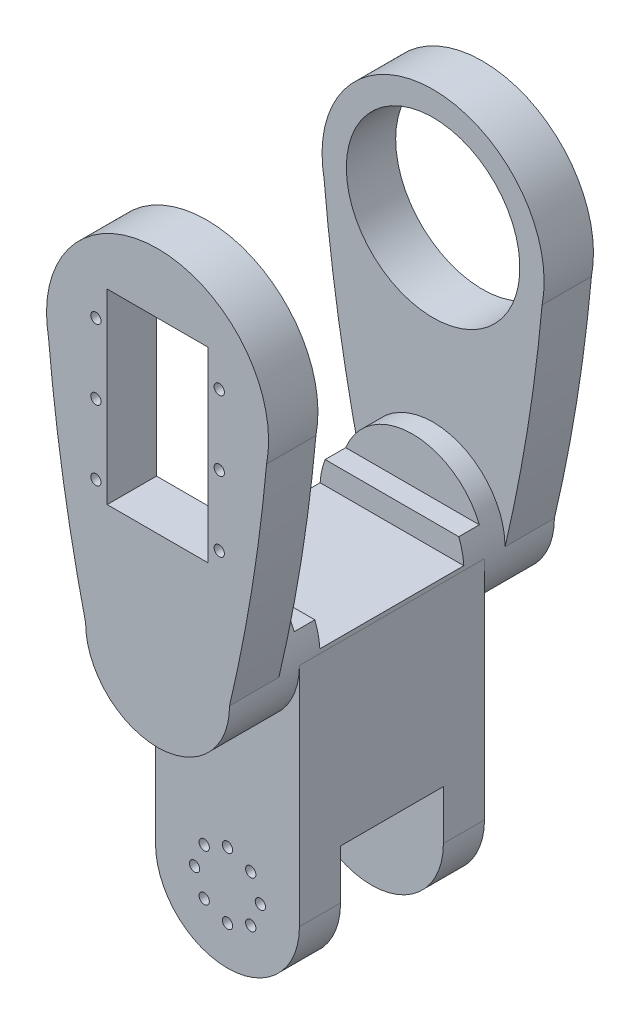
from build123d import *
from build123d.topology import SkipClean

# Parameters (mm, degrees)
SKETCH2_W            = 35
SKETCH2_H            = 55
BOSS_EXTRUDE1_DEPTH  = 45
BOSS_EXTRUDE2_DEPTH  = 5
SKETCH6_R            = 17.5
BOSS_EXTRUDE3_DEPTH  = 12
BOSS_EXTRUDE4_START  = 5
BOSS_EXTRUDE4_DEPTH  = 5
BOSS_EXTRUDE5_START  = 12
SKETCH8_R            = 17.5
BOSS_EXTRUDE5_DEPTH  = 12
BOSS_EXTRUDE6_START  = -12
BOSS_EXTRUDE6_DEPTH  = 12
BOSS_EXTRUDE7_DEPTH  = 12
SKETCH14_W           = 24.5
SKETCH14_H           = 45.4
SKETCH14_R           = 2.449946242
CUT_EXTRUDE3_DEPTH   = 12
SKETCH15_R           = 21.1
CUT_EXTRUDE4_DEPTH   = 12
CUT_EXTRUDE5_DEPTH   = 139.069755203
SKETCH21_R           = 1.25
CUT_EXTRUDE7_DEPTH   = 12
SKETCH23_R           = 10.1
BOSS_EXTRUDE8_DEPTH  = 6
SKETCH24_R           = 8.5
CUT_EXTRUDE8_DEPTH   = 6
SKETCH25_R           = 2.7
CUT_EXTRUDE9_DEPTH   = 18
BOSS_EXTRUDE9_START  = -12
BOSS_EXTRUDE9_DEPTH  = 12
SKETCH30_R           = 1.25
CUT_EXTRUDE11_DEPTH  = 12
SKETCH31_R           = 2
CUT_EXTRUDE12_DEPTH  = 2.5
BOSS_EXTRUDE11_DEPTH = 12
SKETCH33_W           = 17.5
SKETCH33_H           = 5.5
SKETCH33_W_2         = 45
SKETCH33_H_2         = 11
CUT_EXTRUDE13_DEPTH  = 40


with BuildPart() as part:
    # Sketch2 → Boss-Extrude1 (new body)
    with BuildSketch(Plane.XY):
        with BuildLine():
            ThreePointArc((-17.5, 27.5), (0, 45), (17.5, 27.5))
            Line((17.5, 27.5), (-17.5, 27.5))
        make_face()
        Rectangle(SKETCH2_W, SKETCH2_H)
        with BuildLine():
            ThreePointArc((17.5, -27.5), (0, -45), (-17.5, -27.5))
            Line((-17.5, -27.5), (17.5, -27.5))
        make_face()
    extrude(amount=BOSS_EXTRUDE1_DEPTH)

    # Sketch5 → Boss-Extrude2 (add)
    with SkipClean():  # the faces are left unmerged after this step: merging them gives an invalid solid
        with BuildSketch(Plane.XY.offset(45)):
            with BuildLine():
                ThreePointArc((17.5, 27.5), (0, 45), (-17.5, 27.5))
                ThreePointArc((-17.5, 27.5), (0, 10), (17.5, 27.5))
            make_face()
        extrude(amount=BOSS_EXTRUDE2_DEPTH)

    # Sketch6 → Boss-Extrude3 (add)
    with BuildSketch(Plane.XY.offset(50)):
        with BuildLine():
            Line((-17.5, 67.5), (17.5, 67.5))
            ThreePointArc((17.5, 67.5), (0, 85), (-17.5, 67.5))
        make_face()
        with BuildLine():
            Line((17.5, 27.5), (17.5, 67.5))
            Line((17.5, 67.5), (-17.5, 67.5))
            Line((-17.5, 67.5), (-17.5, 27.5))
            ThreePointArc((-17.5, 27.5), (0, 45), (17.5, 27.5))
        make_face()
        with Locations(Location((0, 27.5, 0), (0, 0, 180))):
            Circle(SKETCH6_R)
    extrude(amount=BOSS_EXTRUDE3_DEPTH)

    # Sketch7 → Boss-Extrude4 (add)
    with SkipClean():  # the faces are left unmerged after this step: merging them gives an invalid solid
        with BuildSketch(Plane(origin=(0, 0, 0), x_dir=(-1, 0, 0), z_dir=(0, 0, -1)).offset(BOSS_EXTRUDE4_START)):
            with BuildLine():
                ThreePointArc((17.5, 27.5), (0, 10), (-17.5, 27.5))
                ThreePointArc((-17.5, 27.5), (0, 45), (17.5, 27.5))
            make_face()
        extrude(amount=-BOSS_EXTRUDE4_DEPTH)
    add(part.part.scale(1), mode=Mode.REPLACE)  # the faces are merged on a copy

    # Sketch8 → Boss-Extrude5 (add)
    with SkipClean():  # the faces are left unmerged after this step: merging them gives an invalid solid
        with BuildSketch(Plane(origin=(0, 0, -5), x_dir=(-1, 0, 0), z_dir=(0, 0, -1)).offset(BOSS_EXTRUDE5_START)):
            with BuildLine():
                Line((17.5, 67.5), (-17.5, 67.5))
                ThreePointArc((-17.5, 67.5), (0, 85), (17.5, 67.5))
            make_face()
            with BuildLine():
                ThreePointArc((-17.5, 27.5), (0, 45), (17.5, 27.5))
                Line((17.5, 27.5), (17.5, 67.5))
                Line((17.5, 67.5), (-17.5, 67.5))
                Line((-17.5, 67.5), (-17.5, 27.5))
            make_face()
            with Locations((0, 27.5)):
                Circle(SKETCH8_R)
        extrude(amount=-BOSS_EXTRUDE5_DEPTH)

    # Sketch11 → Boss-Extrude6 (add)
    with BuildSketch(Plane.XY.offset(62).offset(BOSS_EXTRUDE6_START)):
        with BuildLine():
            Line((-17.5, 67.5), (-17.5, 27.5))
            ThreePointArc((-17.5, 27.5), (0, 10), (17.5, 27.5))
            Line((17.5, 27.5), (17.5, 67.5))
            ThreePointArc((17.5, 67.5), (0, 115.060885195), (-17.5, 67.5))
        make_face()
    extrude(amount=BOSS_EXTRUDE6_DEPTH)

    # Sketch12 → Boss-Extrude7 (add)
    with BuildSketch(Plane(origin=(0, 0, -17), x_dir=(-1, 0, 0), z_dir=(0, 0, -1))):
        with BuildLine():
            ThreePointArc((17.5, 67.5), (0, 115.060885195), (-17.5, 67.5))
            ThreePointArc((-17.5, 67.5), (0, 85), (17.5, 67.5))
        make_face()
    extrude(amount=-BOSS_EXTRUDE7_DEPTH)

    # Sketch14 → Cut-Extrude3 (cut)
    # profile 1 of 2: a face of its own
    with BuildSketch(Plane.XY.offset(62)):
        with Locations((0, 77.710885195)):
            Rectangle(SKETCH14_W, SKETCH14_H)
        with Locations((0, 88.060885195)):
            Circle(SKETCH14_R, mode=Mode.SUBTRACT)
    # profile 2 of 2: a face of its own
    with BuildSketch(Plane.XY.offset(62)):
        with Locations((0, 88.060885195)):
            Circle(SKETCH14_R)
    extrude(amount=-CUT_EXTRUDE3_DEPTH, mode=Mode.SUBTRACT)

    # Sketch15 → Cut-Extrude4 (cut)
    with BuildSketch(Plane(origin=(0, 0, -17), x_dir=(-1, 0, 0), z_dir=(0, 0, -1))):
        with Locations((0, 88.060885195)):
            Circle(SKETCH15_R)
    extrude(amount=-CUT_EXTRUDE4_DEPTH, mode=Mode.SUBTRACT)

    # Sketch17 → Cut-Extrude5 (cut, through all)
    with BuildSketch(Plane.ZY.offset(17.5)):
        Polygon((10, -27.5), (22.5, -27.5), (35, -27.5), (35, -15.5), (10, -15.5), align=None)
        Polygon((35, -27.5), (22.5, -27.5), (10, -27.5), (10, -45), (35, -45), align=None)
    extrude(amount=-CUT_EXTRUDE5_DEPTH, mode=Mode.SUBTRACT)

    # Sketch21 → Cut-Extrude7 (cut)
    with BuildSketch(Plane.XY.offset(45)):
        with Locations((8, -27.5)):
            Circle(SKETCH21_R)
        with Locations((5.656854249, -33.156854249)):
            Circle(SKETCH21_R)
        with Locations((0, -35.5)):
            Circle(SKETCH21_R)
        with Locations((-5.656854249, -33.156854249)):
            Circle(SKETCH21_R)
        with Locations((-8, -27.5)):
            Circle(SKETCH21_R)
        with Locations((-5.656854249, -21.843145751)):
            Circle(SKETCH21_R)
        with Locations((0, -19.5)):
            Circle(SKETCH21_R)
        with Locations((5.656854249, -21.843145751)):
            Circle(SKETCH21_R)
    extrude(amount=-CUT_EXTRUDE7_DEPTH, mode=Mode.SUBTRACT)

    # Sketch23 → Boss-Extrude8 (add)
    with BuildSketch(Plane(origin=(0, 0, 0), x_dir=(-1, 0, 0), z_dir=(0, 0, -1))):
        with Locations(Location((0, -27.5, 0), (0, 0, 180))):
            Circle(SKETCH23_R)
    extrude(amount=BOSS_EXTRUDE8_DEPTH)

    # Sketch24 → Cut-Extrude8 (cut)
    with BuildSketch(Plane(origin=(0, 0, -6), x_dir=(-1, 0, 0), z_dir=(0, 0, -1))):
        with Locations((0, -27.5)):
            Circle(SKETCH24_R)
    extrude(amount=-CUT_EXTRUDE8_DEPTH, mode=Mode.SUBTRACT)

    # Sketch25 → Cut-Extrude9 (cut)
    with BuildSketch(Plane(origin=(0, 0, 0), x_dir=(-1, 0, 0), z_dir=(0, 0, -1))):
        with Locations((0, -27.5)):
            Circle(SKETCH25_R)
    extrude(amount=-CUT_EXTRUDE9_DEPTH, mode=Mode.SUBTRACT)

    # Sketch26 → Boss-Extrude9 (add)
    with BuildSketch(Plane.XY.offset(62).offset(BOSS_EXTRUDE9_START)):
        with BuildLine():
            ThreePointArc((-17.5, 67.5), (-23.313699367, 74.442095901), (-26.505269682, 82.915918813))
            ThreePointArc((-26.505269682, 82.915918813), (-22.976087169, 55.049770191), (-17.5, 27.5))
            Line((-17.5, 27.5), (-17.5, 67.5))
        make_face()
        with BuildLine():
            ThreePointArc((17.5, 27.5), (22.976087169, 55.049770191), (26.505269682, 82.915918813))
            ThreePointArc((26.505269682, 82.915918813), (23.313699367, 74.442095901), (17.5, 67.5))
            Line((17.5, 67.5), (17.5, 27.5))
        make_face()
    extrude(amount=BOSS_EXTRUDE9_DEPTH)

    # Sketch30 → Cut-Extrude11 (cut)
    with BuildSketch(Plane.XY.offset(62)):
        with Locations((15, 92.910885195)):
            Circle(SKETCH30_R)
        with Locations((15, 75.910885195)):
            Circle(SKETCH30_R)
        with Locations((15, 58.910885195)):
            Circle(SKETCH30_R)
        with Locations(Location((-15, 92.910885195, 0), (0, 0, 180))):
            Circle(SKETCH30_R)
        with Locations(Location((-15, 75.910885195, 0), (0, 0, 180))):
            Circle(SKETCH30_R)
        with Locations(Location((-15, 58.910885195, 0), (0, 0, 180))):
            Circle(SKETCH30_R)
    extrude(amount=-CUT_EXTRUDE11_DEPTH, mode=Mode.SUBTRACT)

    # Sketch31 → Cut-Extrude12 (cut)
    with BuildSketch(Plane(origin=(0, 0, 50), x_dir=(-1, 0, 0), z_dir=(0, 0, -1))):
        with Locations((15, 92.910885195)):
            Circle(SKETCH31_R)
        with Locations((15, 75.910885195)):
            Circle(SKETCH31_R)
        with Locations((15, 58.910885195)):
            Circle(SKETCH31_R)
        with Locations(Location((-15, 58.910885195, 0), (0, 0, 180))):
            Circle(SKETCH31_R)
        with Locations(Location((-15, 75.910885195, 0), (0, 0, 180))):
            Circle(SKETCH31_R)
        with Locations(Location((-15, 92.910885195, 0), (0, 0, 180))):
            Circle(SKETCH31_R)
    extrude(amount=-CUT_EXTRUDE12_DEPTH, mode=Mode.SUBTRACT)

    # Sketch32 → Boss-Extrude11 (add)
    with BuildSketch(Plane(origin=(0, 0, -17), x_dir=(-1, 0, 0), z_dir=(0, 0, -1))):
        with BuildLine():
            ThreePointArc((-17.5, 67.5), (-23.313699367, 74.442095901), (-26.505269682, 82.915918813))
            ThreePointArc((-26.505269682, 82.915918813), (-22.976087169, 55.049770191), (-17.5, 27.5))
            Line((-17.5, 27.5), (-17.5, 67.5))
        make_face()
        with BuildLine():
            ThreePointArc((17.5, 27.5), (22.976087169, 55.049770191), (26.505269682, 82.915918813))
            ThreePointArc((26.505269682, 82.915918813), (23.313699367, 74.442095901), (17.5, 67.5))
            Line((17.5, 67.5), (17.5, 27.5))
        make_face()
    extrude(amount=-BOSS_EXTRUDE11_DEPTH)

    # Sketch33 → Cut-Extrude13 (cut)
    with BuildSketch(Plane.ZY.offset(17.5)):
        with Locations((13.75, 31.25)):
            Rectangle(SKETCH33_W, SKETCH33_H)
        with Locations((31.25, 31.25)):
            Rectangle(SKETCH33_W, SKETCH33_H)
        with Locations((22.5, 39.5)):
            Rectangle(SKETCH33_W_2, SKETCH33_H_2)
    extrude(amount=-CUT_EXTRUDE13_DEPTH, mode=Mode.SUBTRACT)


solid = part.part
